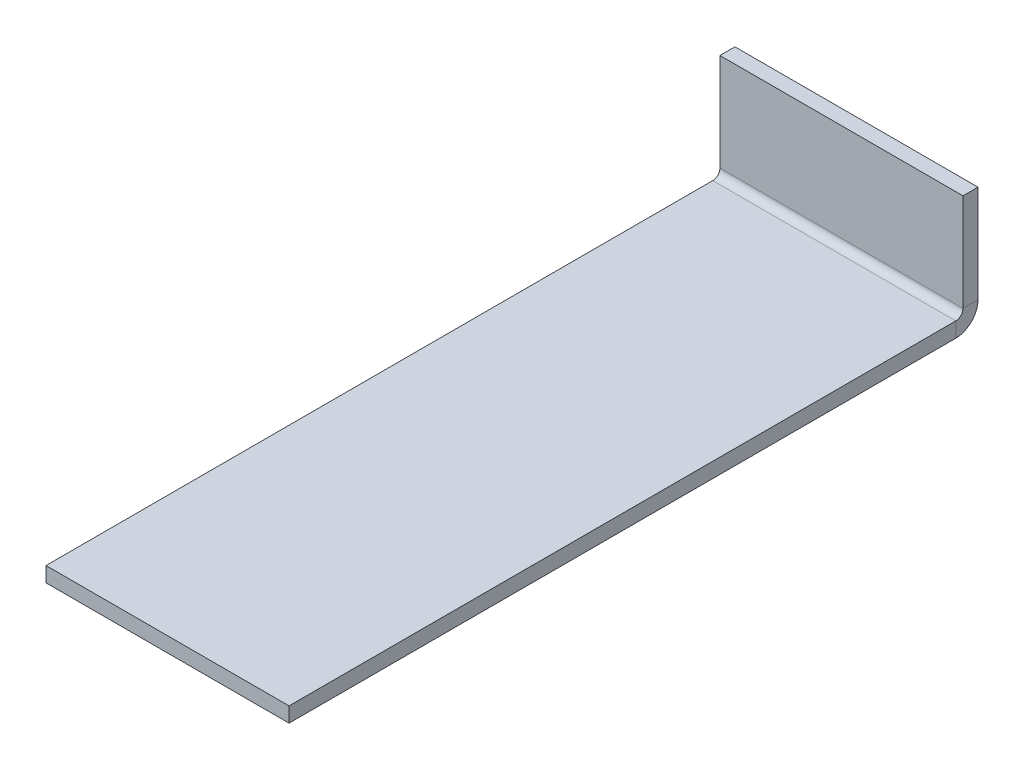
from build123d import *

# Parameters (mm, degrees)
BASE_FLANGE1_DEPTH     = 1.524
SKETCHED_START         = -12.348324115
SKETCHED_BEND6_DEPTH   = 24.69664823
SKETCHED_BEND6_2_DEPTH = 24.69664823


# Read off the part's stored shape, not the designer's step: Sketched Bend6
# Sheet-metal steps are written as plain solids
with BuildPart() as part:
    # Sketch2 → Base-Flange1 (new body)
    with BuildSketch(Plane(origin=(0, 0, 0), x_dir=(1, 0, 0), z_dir=(0, 1, 0))):
        Polygon((12.348324115, -35), (12.348324115, 35), (12.348324115, 45), (-12.348324115, 45), (-12.348324115, 35), (-12.348324115, -35), align=None)
    extrude(amount=-BASE_FLANGE1_DEPTH)

    # Sketched Bend6 outline → Sketched Bend6 (cut)
    with BuildSketch(Plane.YZ.offset(SKETCHED_START)):
        with BuildLine():
            Line((0, -45), (0, -34.876625492))
            ThreePointArc((0, -34.876625492), (-1.103980115, -34.051869886), (-1.524, -32.7394))
            Line((-1.524, -32.7394), (-1.524, -45))
            Line((-1.524, -45), (0, -45))
        make_face()
    extrude(amount=SKETCHED_BEND6_DEPTH, mode=Mode.SUBTRACT)

    # Sketched Bend6 2 outline → Sketched Bend6 2 (add)
    with BuildSketch(Plane.YZ.offset(SKETCHED_START)):
        with BuildLine():
            Line((10.643204625, -33.476), (0.7366, -33.476))
            ThreePointArc((0.7366, -33.476), (0.215745145, -33.260254855), (0, -32.7394))
            Line((0, -32.7394), (0, -34.876625492))
            ThreePointArc((0, -34.876625492), (0.363169675, -34.968943037), (0.7366, -35))
            Line((0.7366, -35), (10.643204625, -35))
            Line((10.643204625, -35), (10.643204625, -33.476))
        make_face()
    extrude(amount=SKETCHED_BEND6_2_DEPTH)


solid = part.part
